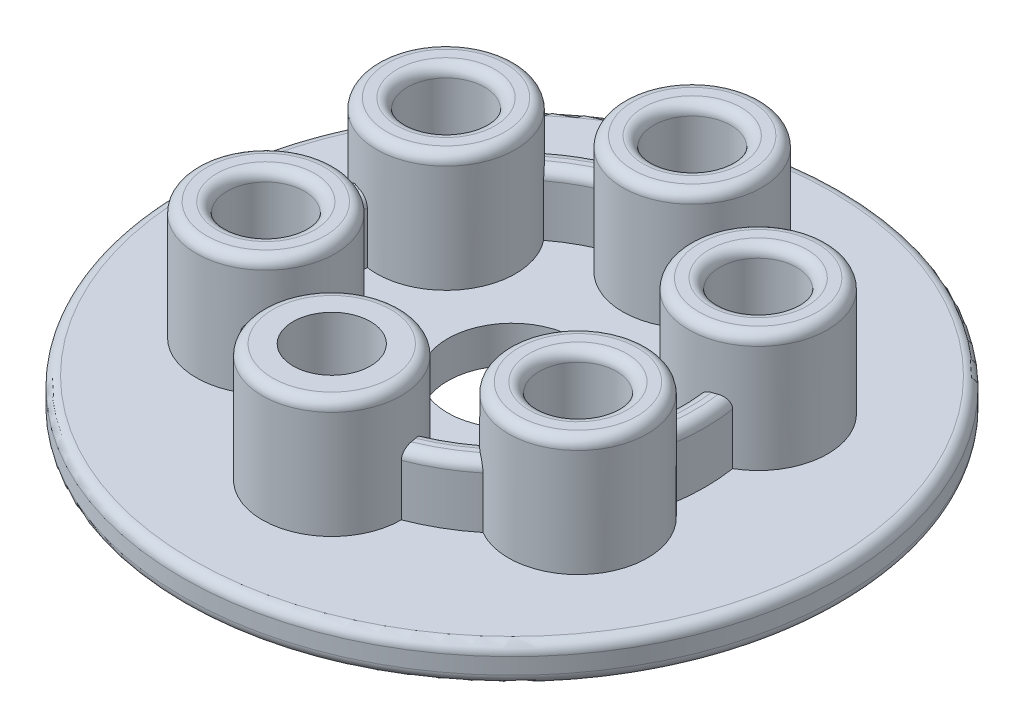
from build123d import *

# Parameters (mm, degrees)
SKETCH_1_R                       = 64
EXTRUDE_1_DEPTH                  = 7.125195128
SKETCH_2_R                       = 37.5
SKETCH_2_R_2                     = 32.5
EXTRUDE_2_DEPTH                  = 12
SKETCH_3_R                       = 12.5
CUT_EXTRUDE_1_DEPTH              = 92.301697684
FILLET_1_R                       = 2
SKETCH_5_R                       = 13.5
EXTRUDE_7_DEPTH                  = 30
SKETCH_6_R                       = 7.5
CUT_EXTRUDE_4_DEPTH              = 96.351979596
PATTERN_CIRCULAR_1_OUTLINE_R     = 7.5
PATTERN_CIRCULAR_1_DEPTH         = 19.125195128
PATTERN_START                    = 7.125195128
PATTERN_CIRCULAR_1_2_OUTLINE_R   = 13.5
PATTERN_CIRCULAR_1_2_OUTLINE_R_2 = 7.5
PATTERN_CIRCULAR_1_2_DEPTH       = 22.874804872
FILLET_2_R                       = 2


# Read off the part's stored shape, not the designer's step: 環狀複製排列1
with BuildPart() as part:
    # 草圖1 → 填料-伸長1 (new body)
    with BuildSketch(Plane(origin=(0, 0, 0), x_dir=(1, 0, 0), z_dir=(0, 1, 0))):
        with Locations(Location((0, 0, 0), (0, 0, 270))):
            Circle(SKETCH_1_R)
    extrude(amount=EXTRUDE_1_DEPTH)

    # 草圖2 → 填料-伸長2 (add)
    with BuildSketch(Plane(origin=(0, 7.125195128, 0), x_dir=(1, 0, 0), z_dir=(0, 1, 0))):
        with Locations(Location((0, 0, 0), (0, 0, 270))):
            Circle(SKETCH_2_R)
        with Locations(Location((0, 0, 0), (0, 0, 270))):
            Circle(SKETCH_2_R_2, mode=Mode.SUBTRACT)
    extrude(amount=EXTRUDE_2_DEPTH)

    # 草圖3 → 除料-伸長1 (cut, through all)
    with BuildSketch(Plane(origin=(0, 7.125195128, 0), x_dir=(1, 0, 0), z_dir=(0, 1, 0))):
        with Locations(Location((0, 0, 0), (0, 0, 270))):
            Circle(SKETCH_3_R)
    extrude(amount=-CUT_EXTRUDE_1_DEPTH, mode=Mode.SUBTRACT)

    # 圓角1
    fillet_1_edges = [part.edges().sort_by_distance(p)[0] for p in [
        (0, 0, -64),
        (0, 7.125195128, -64),
        (0, 19.125195128, -37.5),
        (0, 19.125195128, -32.5),
    ]]
    fillet(fillet_1_edges, radius=FILLET_1_R)

    # 草圖5 → 填料-伸長7 (add)
    with BuildSketch(Plane(origin=(0, 0, 0), x_dir=(1, 0, 0), z_dir=(0, 1, 0))):
        with Locations(Location((0, 35, 0), (0, 0, 359.939369671))):
            Circle(SKETCH_5_R)
    extrude(amount=EXTRUDE_7_DEPTH)

    # 草圖6 → 除料-伸長4 (cut, through all)
    with BuildSketch(Plane(origin=(0, 30, 0), x_dir=(1, 0, 0), z_dir=(0, 1, 0))):
        with Locations(Location((0, 35, 0), (0, 0, 270))):
            Circle(SKETCH_6_R)
    extrude(amount=-CUT_EXTRUDE_4_DEPTH, mode=Mode.SUBTRACT)

    # 環狀複製排列1 outline → 環狀複製排列1 (cut)
    with BuildSketch(Plane(origin=(0, 0, 0), x_dir=(1, 0, 0), z_dir=(0, 1, 0))):
        with Locations((-30.310889132, 17.5)):
            Circle(PATTERN_CIRCULAR_1_OUTLINE_R)
        with Locations((-30.310889132, -17.5)):
            Circle(PATTERN_CIRCULAR_1_OUTLINE_R)
        with Locations((0, -35)):
            Circle(PATTERN_CIRCULAR_1_OUTLINE_R)
        with Locations((30.310889132, -17.5)):
            Circle(PATTERN_CIRCULAR_1_OUTLINE_R)
        with Locations((30.310889132, 17.5)):
            Circle(PATTERN_CIRCULAR_1_OUTLINE_R)
    extrude(amount=PATTERN_CIRCULAR_1_DEPTH, mode=Mode.SUBTRACT)

    # Pattern Circular 1 2 outline → Pattern Circular 1 2 (add)
    # profile 1 of 5: a face of its own
    with BuildSketch(Plane(origin=(0, 0, 0), x_dir=(1, 0, 0), z_dir=(0, 1, 0)).offset(PATTERN_START)):
        with Locations((-30.310889132, 17.5)):
            Circle(PATTERN_CIRCULAR_1_2_OUTLINE_R)
        with Locations((-30.310889132, 17.5)):
            Circle(PATTERN_CIRCULAR_1_2_OUTLINE_R_2, mode=Mode.SUBTRACT)
    # profile 2 of 5: a face of its own
    with BuildSketch(Plane(origin=(0, 0, 0), x_dir=(1, 0, 0), z_dir=(0, 1, 0)).offset(PATTERN_START)):
        with Locations((-30.310889132, -17.5)):
            Circle(PATTERN_CIRCULAR_1_2_OUTLINE_R)
        with Locations((-30.310889132, -17.5)):
            Circle(PATTERN_CIRCULAR_1_2_OUTLINE_R_2, mode=Mode.SUBTRACT)
    # profile 3 of 5: a face of its own
    with BuildSketch(Plane(origin=(0, 0, 0), x_dir=(1, 0, 0), z_dir=(0, 1, 0)).offset(PATTERN_START)):
        with Locations((0, -35)):
            Circle(PATTERN_CIRCULAR_1_2_OUTLINE_R)
        with Locations((0, -35)):
            Circle(PATTERN_CIRCULAR_1_2_OUTLINE_R_2, mode=Mode.SUBTRACT)
    # profile 4 of 5: a face of its own
    with BuildSketch(Plane(origin=(0, 0, 0), x_dir=(1, 0, 0), z_dir=(0, 1, 0)).offset(PATTERN_START)):
        with Locations((30.310889132, -17.5)):
            Circle(PATTERN_CIRCULAR_1_2_OUTLINE_R)
        with Locations((30.310889132, -17.5)):
            Circle(PATTERN_CIRCULAR_1_2_OUTLINE_R_2, mode=Mode.SUBTRACT)
    # profile 5 of 5: a face of its own
    with BuildSketch(Plane(origin=(0, 0, 0), x_dir=(1, 0, 0), z_dir=(0, 1, 0)).offset(PATTERN_START)):
        with Locations((30.310889132, 17.5)):
            Circle(PATTERN_CIRCULAR_1_2_OUTLINE_R)
        with Locations((30.310889132, 17.5)):
            Circle(PATTERN_CIRCULAR_1_2_OUTLINE_R_2, mode=Mode.SUBTRACT)
    extrude(amount=PATTERN_CIRCULAR_1_2_DEPTH)

    # 圓角2
    fillet_2_edges = [part.edges().sort_by_distance(p)[0] for p in [
        (16.810889132, 30, 17.5),
        (16.810889132, 30, -17.5),
        (-37.810889132, 30, -17.5),
        (-37.810889132, 30, 17.5),
        (22.810889132, 30, 17.5),
        (22.810889132, 30, -17.5),
        (-13.499992441, 30, -35.014285682),
        (0, 30, -42.5),
        (-43.810889132, 30, -17.5),
        (-43.810889132, 30, 17.5),
        (-13.5, 30, 35),
    ]]
    fillet(fillet_2_edges, radius=FILLET_2_R)


solid = part.part
